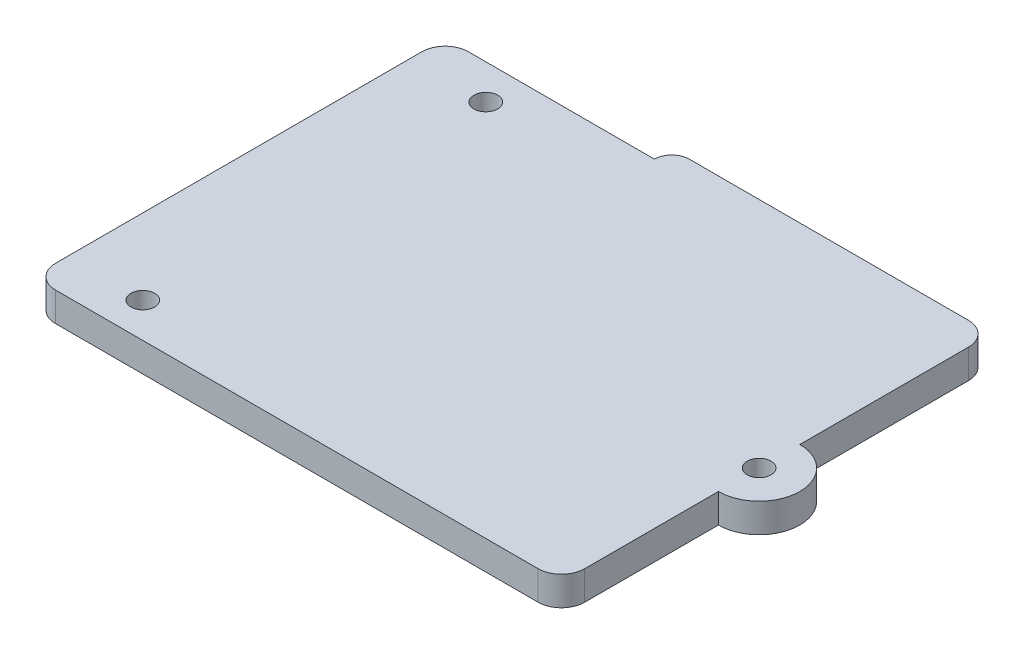
from build123d import *

# Parameters (mm, degrees)
SKETCH1_R                = 0.5
BOSS_EXTRUDE1_DEPTH      = 2.5
FILLET1_R                = 2
FILLET2_R                = 1.5
M2_5X0_45_TAPPED_HOLE1_D = 2.05


with BuildPart() as part:
    # Sketch1 → Boss-Extrude1 (new body)
    with BuildSketch(Plane(origin=(0, 0, 0), x_dir=(1, 0, 0), z_dir=(0, 1, 0))):
        with BuildLine():
            Line((0, 0), (45.5, 0))
            Line((45.5, 0), (45.5, 13.5))
            ThreePointArc((45.5, 13.5), (49, 17), (45.5, 20.5))
            Line((45.5, 20.5), (45.5, 37))
            Line((45.5, 37), (18, 37))
            Line((18, 37), (18, 35.5))
            Line((18, 35.5), (0, 35.5))
            Line((0, 35.5), (0, 0))
        make_face()
        with Locations(Location((45.5, 17, 0), (0, 0, 270))):
            Circle(SKETCH1_R, mode=Mode.SUBTRACT)
        with Locations(Location((6.5, 3, 0), (0, 0, 270))):
            Circle(SKETCH1_R, mode=Mode.SUBTRACT)
        with Locations(Location((6.5, 32.5, 0), (0, 0, 270))):
            Circle(SKETCH1_R, mode=Mode.SUBTRACT)
    extrude(amount=BOSS_EXTRUDE1_DEPTH)

    # Fillet1
    fillet1_edges = [part.edges().sort_by_distance(p)[0] for p in [
        (0, 1.25, -35.5),
        (45.5, 1.25, -37),
        (45.5, 1.25, 0),
        (0, 1.25, 0),
    ]]
    fillet(fillet1_edges, radius=FILLET1_R)

    # Fillet2
    fillet2_edges = [part.edges().sort_by_distance(p)[0] for p in [
        (18, 1.25, -37),
    ]]
    fillet(fillet2_edges, radius=FILLET2_R - 0.0001)  # a hair under: the kernel refuses the full size

    # M2.5x0.45 Tapped Hole1 (through all)
    with Locations(Plane(origin=(0, 2.5, 0), x_dir=(1, 0, 0), z_dir=(0, 1, 0))):
        with Locations((6.5, 32.5), (6.5, 3), (45.5, 17)):
            Hole(M2_5X0_45_TAPPED_HOLE1_D / 2)


solid = part.part
